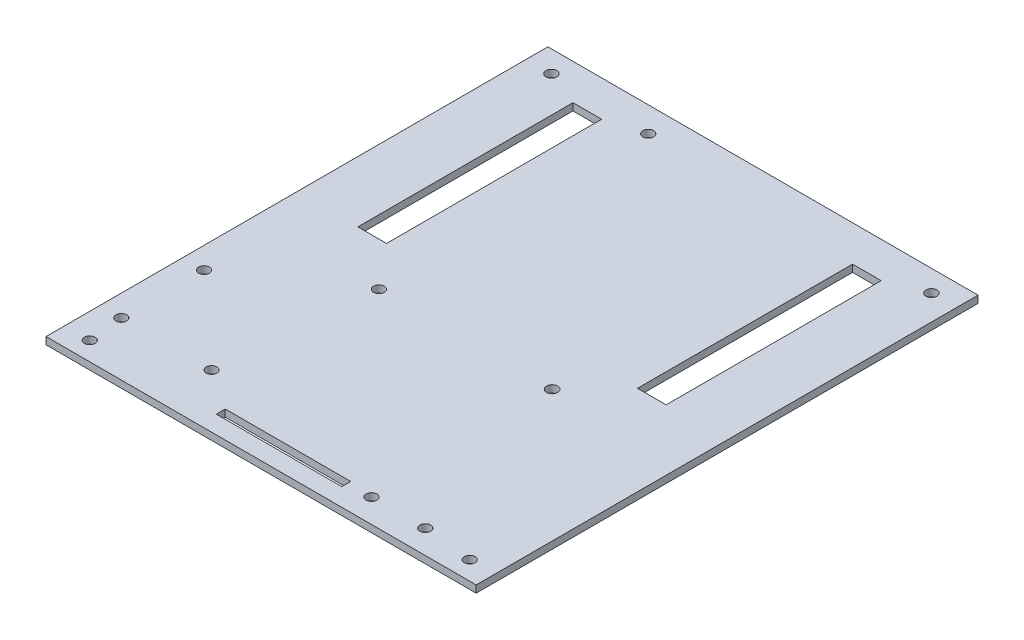
from build123d import *

# Parameters (mm, degrees)
SKETCH1_W           = 120
SKETCH1_H           = 140
BOSS_EXTRUDE1_DEPTH = 2
SKETCH2_R           = 1.525
SKETCH2_R_2         = 1.5
CUT_EXTRUDE1_DEPTH  = 2
SKETCH4_R           = 1.5
SKETCH4_R_2         = 1.55
SKETCH4_W           = 8
SKETCH4_H           = 60
CUT_EXTRUDE2_DEPTH  = 93.217135067
SKETCH5_R           = 1.5
SKETCH5_W           = 35
SKETCH5_H           = 2.5
CUT_EXTRUDE3_DEPTH  = 93.217135067


with BuildPart() as part:
    # Sketch1 → Boss-Extrude1 (new body)
    with BuildSketch(Plane(origin=(0, 0, 0), x_dir=(1, 0, 0), z_dir=(0, 1, 0))):
        Rectangle(SKETCH1_W, SKETCH1_H)
    extrude(amount=BOSS_EXTRUDE1_DEPTH)

    # Sketch2 → Cut-Extrude1 (cut)
    with BuildSketch(Plane(origin=(0, 2, 0), x_dir=(1, 0, 0), z_dir=(0, 1, 0))):
        with Locations((-53, 64)):
            Circle(SKETCH2_R)
        with Locations((-53, -64.8)):
            Circle(SKETCH2_R_2)
        with Locations((53, 64)):
            Circle(SKETCH2_R)
        with Locations((53, -64.8)):
            Circle(SKETCH2_R_2)
    extrude(amount=-CUT_EXTRUDE1_DEPTH, mode=Mode.SUBTRACT)

    # Sketch4 → Cut-Extrude2 (cut, through all)
    with BuildSketch(Plane(origin=(0, 2, 0), x_dir=(1, 0, 0), z_dir=(0, 1, 0))):
        with Locations((-25, 63)):
            Circle(SKETCH4_R)
        with Locations((-25, -12.13)):
            Circle(SKETCH4_R)
        with Locations((23.33, -12.13)):
            Circle(SKETCH4_R_2)
        with Locations((-39, 30)):
            Rectangle(SKETCH4_W, SKETCH4_H)
        with Locations((39, 30)):
            Rectangle(SKETCH4_W, SKETCH4_H)
    extrude(amount=-CUT_EXTRUDE2_DEPTH, mode=Mode.SUBTRACT)

    # Sketch5 → Cut-Extrude3 (cut, through all)
    with BuildSketch(Plane(origin=(0, 2, 0), x_dir=(1, 0, 0), z_dir=(0, 1, 0))):
        with Locations((-54, -55)):
            Circle(SKETCH5_R)
        with Locations((-28.82, -55)):
            Circle(SKETCH5_R)
        with Locations((-54, -31.9)):
            Circle(SKETCH5_R)
        with Locations((24.183561374, -63.38263981)):
            Circle(SKETCH5_R)
        with Locations((39.183561374, -63.38263981)):
            Circle(SKETCH5_R)
        with Locations((0, -63.75)):
            Rectangle(SKETCH5_W, SKETCH5_H)
    extrude(amount=-CUT_EXTRUDE3_DEPTH, mode=Mode.SUBTRACT)


solid = part.part
